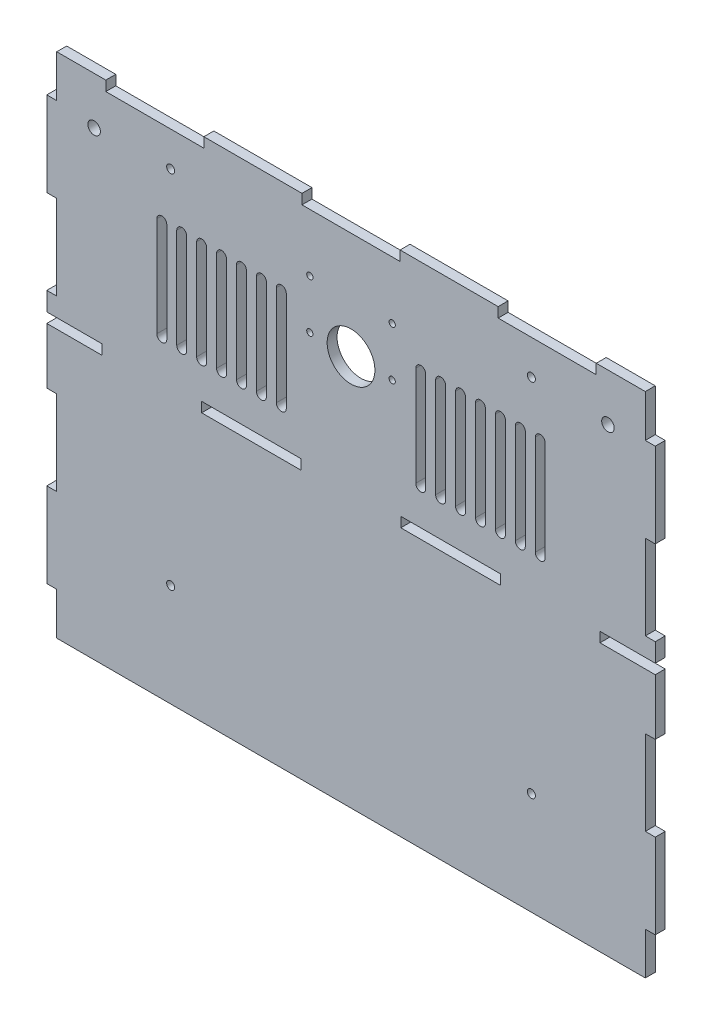
from build123d import *

# Parameters (mm, degrees)
SKETCH1_W                      = 150.114
SKETCH1_H                      = 129.54
BOSS_EXTRUDE1_DEPTH            = 2.54
SKETCH4_W                      = 25.019
SKETCH4_H                      = 2.54
CUT_EXTRUDE1_DEPTH             = 100.172363837
LPATTERN1_COUNT                = 3
LPATTERN1_PITCH                = 50.038
SKETCH5_W                      = 2.54
SKETCH5_H                      = 21.59
BOSS_EXTRUDE3_DEPTH            = 2.54
LPATTERN2_COUNT                = 3
LPATTERN2_PITCH                = 43.18
LPATTERN2_COUNT_DIR2           = 2
LPATTERN2_PITCH_DIR2           = 152.654
TAP_DRILL_FOR_M2_5X0_45_TAP1_D = 2.05
M3_CLEARANCE_HOLE1_D           = 3.2
M3_CLEARANCE_HOLE1_DEPTH       = 9.398
M3_CLEARANCE_HOLE1_TIP         = 0.96137699
SKETCH10_R                     = 6.096
CUT_EXTRUDE2_DEPTH             = 102.108352321
TAP_DRILL_FOR_M2X0_4_TAP1_D    = 1.6
SKETCH13_W                     = 25.4
SKETCH13_H                     = 2.54
CUT_EXTRUDE3_DEPTH             = 102.108352321
CUT_EXTRUDE4_DEPTH             = 102.108352321
LPATTERN3_COUNT                = 7
LPATTERN3_PITCH                = 5.08
LPATTERN3_COUNT_DIR2           = 14
LPATTERN3_PITCH_DIR2           = 5.08


with BuildPart() as part:
    # Sketch1 → Boss-Extrude1 (new body)
    with BuildSketch(Plane.XY):
        Rectangle(SKETCH1_W, SKETCH1_H)
    extrude(amount=BOSS_EXTRUDE1_DEPTH)

    # Sketch4 → Cut-Extrude1 (cut, through all)
    with BuildSketch(Plane.XY.offset(2.54)):
        with Locations((-50.038, 63.5)):
            Rectangle(SKETCH4_W, SKETCH4_H)
    cut_extrude1 = extrude(amount=-CUT_EXTRUDE1_DEPTH, mode=Mode.SUBTRACT)

    # LPattern1: Cut-Extrude1 ×3
    with Locations(*[(i * LPATTERN1_PITCH, 0, 0) for i in range(1, LPATTERN1_COUNT)]):
        add(cut_extrude1, mode=Mode.SUBTRACT)

    # Sketch5 → Boss-Extrude3 (add)
    with BuildSketch(Plane.XY.offset(2.54)):
        with Locations((-76.327, 43.18)):
            Rectangle(SKETCH5_W, SKETCH5_H)
    boss_extrude3 = extrude(amount=-BOSS_EXTRUDE3_DEPTH)

    # LPattern2: Boss-Extrude3 3 × 2
    with Locations(*[(j * LPATTERN2_PITCH_DIR2, -i * LPATTERN2_PITCH, 0) for i in range(LPATTERN2_COUNT) for j in range(LPATTERN2_COUNT_DIR2) if (i, j) != (0, 0)]):
        add(boss_extrude3)

    # Tap Drill for M2.5x0.45 Tap1 (through all)
    with Locations(Plane.XY.offset(2.54)):
        with Locations((46, 53.413478245), (-45.9999938, 53.413478245), (-45.9999938, -38.586515555), (46, -38.586515555)):
            Hole(TAP_DRILL_FOR_M2_5X0_45_TAP1_D / 2)

    # M3 Clearance Hole1
    with Locations(Plane.XY.offset(2.54)):
        with Locations((-65.532, 52.705), (65.532, 52.705)):
            Hole(M3_CLEARANCE_HOLE1_D / 2, depth=M3_CLEARANCE_HOLE1_DEPTH)
            with Locations((0, 0, -(M3_CLEARANCE_HOLE1_DEPTH + M3_CLEARANCE_HOLE1_TIP / 2))):  # 118° drill point
                Cone(0, M3_CLEARANCE_HOLE1_D / 2, M3_CLEARANCE_HOLE1_TIP, mode=Mode.SUBTRACT)

    # Sketch10 → Cut-Extrude2 (cut, through all)
    with BuildSketch(Plane(origin=(0, 0, 0), x_dir=(-1, 0, 0), z_dir=(0, 0, -1))):
        with Locations((0, 34.98)):
            Circle(SKETCH10_R)
    extrude(amount=-CUT_EXTRUDE2_DEPTH, mode=Mode.SUBTRACT)

    # Tap Drill for M2x0.4 Tap1 (through all)
    with Locations(Plane(origin=(0, 0, 0), x_dir=(-1, 0, 0), z_dir=(0, 0, -1))):
        with Locations((-10.5, 47.53), (-10.5, 35.03), (10.5, 47.53), (10.5, 35.03)):
            Hole(TAP_DRILL_FOR_M2X0_4_TAP1_D / 2)

    # Sketch13 → Cut-Extrude3 (cut, through all)
    with BuildSketch(Plane.XY.offset(2.54)):
        with Locations((-25.4, 4.7625)):
            Rectangle(SKETCH13_W, SKETCH13_H)
        with Locations((-76.2, 4.7625)):
            Rectangle(SKETCH13_W, SKETCH13_H)
    cut_extrude3 = extrude(amount=-CUT_EXTRUDE3_DEPTH, mode=Mode.SUBTRACT)

    # Mirror1: Cut-Extrude3 across plane
    add(cut_extrude3.mirror(Plane(origin=(0, 0, 0), x_dir=(0, 0, 1), z_dir=(1, 0, 0))), mode=Mode.SUBTRACT)

    # Sketch14 → Cut-Extrude4 (cut, through all)
    with BuildSketch(Plane.XY.offset(2.54)):
        with BuildLine():
            Line((-16.51, 40.64), (-16.51, 15.24))
            ThreePointArc((-16.51, 15.24), (-17.78, 13.97), (-19.05, 15.24))
            Line((-19.05, 15.24), (-19.05, 40.64))
            ThreePointArc((-19.05, 40.64), (-17.78, 41.91), (-16.51, 40.64))
        make_face()
    cut_extrude4 = extrude(amount=-CUT_EXTRUDE4_DEPTH, mode=Mode.SUBTRACT)

    # LPattern3: Cut-Extrude4 7 × 14, 42 skipped
    with Locations(*[Vector(-1, 0, 0) * (i * LPATTERN3_PITCH) + Vector(1, 0, 0) * (j * LPATTERN3_PITCH_DIR2) for i in range(LPATTERN3_COUNT) for j in range(LPATTERN3_COUNT_DIR2) if (i, j) not in ((0, 0), (0, 1), (0, 2), (0, 3), (0, 4), (0, 5), (0, 6), (1, 2), (1, 3), (1, 4), (1, 5), (1, 6), (1, 7), (2, 3), (2, 4), (2, 5), (2, 6), (2, 7), (2, 8), (3, 4), (3, 5), (3, 6), (3, 7), (3, 8), (3, 9), (4, 5), (4, 6), (4, 7), (4, 8), (4, 9), (4, 10), (5, 6), (5, 7), (5, 8), (5, 9), (5, 10), (5, 11), (6, 7), (6, 8), (6, 9), (6, 10), (6, 11), (6, 12))]):
        add(cut_extrude4, mode=Mode.SUBTRACT)


solid = part.part
